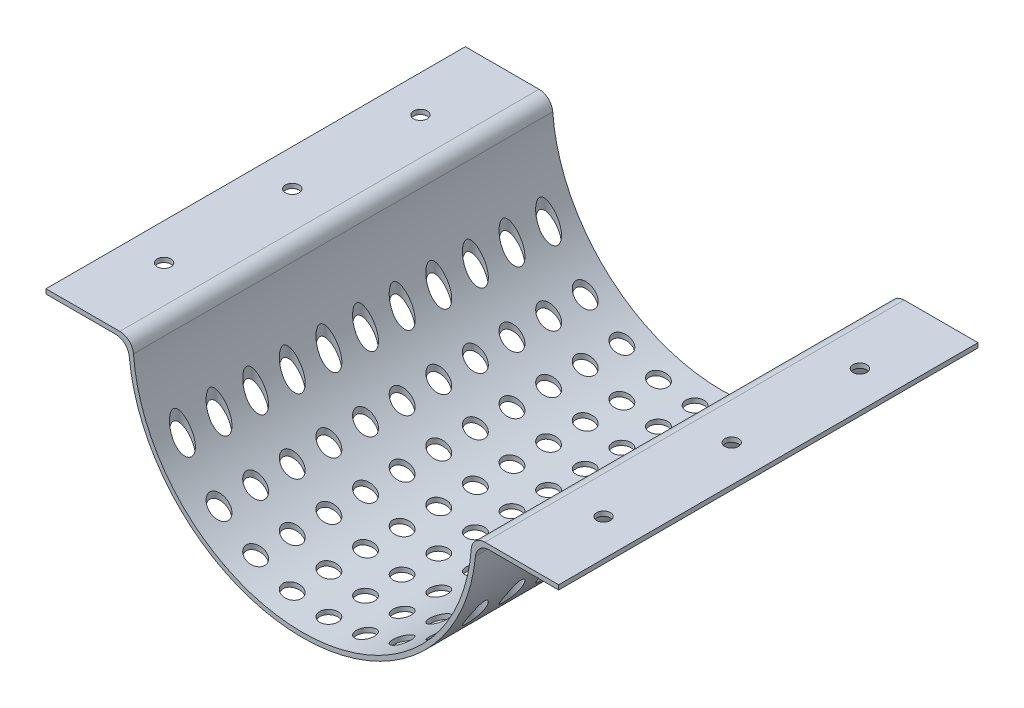
from build123d import *

# Parameters (mm, degrees)
BOSS_EXTRUDE1_DEPTH = 145.415
SKETCH2_R           = 6.35
CUT_EXTRUDE1_DEPTH  = 304.8
SKETCH3_R           = 4.7625
CUT_EXTRUDE2_DEPTH  = 76.2


with BuildPart() as part:
    # Sketch1 → Boss-Extrude1 (new, symmetric)
    with BuildSketch(Plane.XY):
        with BuildLine():
            Line((126.642308787, 0), (177.8, 0))
            Line((177.8, 0), (177.8, -3.175))
            Line((177.8, -3.175), (129.554006596, -3.175))
            ThreePointArc((129.554006596, -3.175), (123.155790262, -5.643906694), (120.074445137, -11.770731707))
            ThreePointArc((120.074445137, -11.770731707), (0, -120.65), (-120.074445137, -11.770731707))
            ThreePointArc((-120.074445137, -11.770731707), (-123.155790262, -5.643906694), (-129.554006596, -3.175))
            Line((-129.554006596, -3.175), (-177.8, -3.175))
            Line((-177.8, -3.175), (-177.8, 0))
            Line((-177.8, 0), (-126.642308787, 0))
            ThreePointArc((-126.642308787, 0), (-120.164608458, -2.54180421), (-117.144135628, -8.810625))
            ThreePointArc((-117.144135628, -8.810625), (0, -117.475), (117.144135628, -8.810625))
            ThreePointArc((117.144135628, -8.810625), (120.164608458, -2.54180421), (126.642308787, 0))
        make_face()
    extrude(amount=BOSS_EXTRUDE1_DEPTH, both=True)

    # Sketch2 → Cut-Extrude1 (cut)
    with BuildSketch(Plane(origin=(0, 0, 0), x_dir=(1, 0, 0), z_dir=(0, 1, 0))):
        Circle(SKETCH2_R)
        with Locations((25.4, 0)):
            Circle(SKETCH2_R)
        with Locations((50.8, 0)):
            Circle(SKETCH2_R)
        with Locations((76.2, 0)):
            Circle(SKETCH2_R)
        with Locations((101.6, 0)):
            Circle(SKETCH2_R)
        with Locations((-50.8, 0)):
            Circle(SKETCH2_R)
        with Locations((-101.6, 0)):
            Circle(SKETCH2_R)
        with Locations((-76.2, 0)):
            Circle(SKETCH2_R)
        with Locations((-25.4, 0)):
            Circle(SKETCH2_R)
        with Locations((0, -25.4)):
            Circle(SKETCH2_R)
        with Locations((25.4, -25.4)):
            Circle(SKETCH2_R)
        with Locations((50.8, -25.4)):
            Circle(SKETCH2_R)
        with Locations((76.2, -25.4)):
            Circle(SKETCH2_R)
        with Locations((101.6, -25.4)):
            Circle(SKETCH2_R)
        with Locations((-50.8, -25.4)):
            Circle(SKETCH2_R)
        with Locations((-101.6, -25.4)):
            Circle(SKETCH2_R)
        with Locations((-76.2, -25.4)):
            Circle(SKETCH2_R)
        with Locations((-25.4, -25.4)):
            Circle(SKETCH2_R)
        with Locations((0, -50.8)):
            Circle(SKETCH2_R)
        with Locations((25.4, -50.8)):
            Circle(SKETCH2_R)
        with Locations((50.8, -50.8)):
            Circle(SKETCH2_R)
        with Locations((76.2, -50.8)):
            Circle(SKETCH2_R)
        with Locations((101.6, -50.8)):
            Circle(SKETCH2_R)
        with Locations((-50.8, -50.8)):
            Circle(SKETCH2_R)
        with Locations((-101.6, -50.8)):
            Circle(SKETCH2_R)
        with Locations((-76.2, -50.8)):
            Circle(SKETCH2_R)
        with Locations((-25.4, -50.8)):
            Circle(SKETCH2_R)
        with Locations((0, -76.2)):
            Circle(SKETCH2_R)
        with Locations((25.4, -76.2)):
            Circle(SKETCH2_R)
        with Locations((50.8, -76.2)):
            Circle(SKETCH2_R)
        with Locations((76.2, -76.2)):
            Circle(SKETCH2_R)
        with Locations((101.6, -76.2)):
            Circle(SKETCH2_R)
        with Locations((-50.8, -76.2)):
            Circle(SKETCH2_R)
        with Locations((-101.6, -76.2)):
            Circle(SKETCH2_R)
        with Locations((-76.2, -76.2)):
            Circle(SKETCH2_R)
        with Locations((-25.4, -76.2)):
            Circle(SKETCH2_R)
        with Locations((0, -101.6)):
            Circle(SKETCH2_R)
        with Locations((25.4, -101.6)):
            Circle(SKETCH2_R)
        with Locations((50.8, -101.6)):
            Circle(SKETCH2_R)
        with Locations((76.2, -101.6)):
            Circle(SKETCH2_R)
        with Locations((101.6, -101.6)):
            Circle(SKETCH2_R)
        with Locations((-50.8, -101.6)):
            Circle(SKETCH2_R)
        with Locations((-101.6, -101.6)):
            Circle(SKETCH2_R)
        with Locations((-76.2, -101.6)):
            Circle(SKETCH2_R)
        with Locations((-25.4, -101.6)):
            Circle(SKETCH2_R)
        with Locations((0, -127)):
            Circle(SKETCH2_R)
        with Locations((25.4, -127)):
            Circle(SKETCH2_R)
        with Locations((50.8, -127)):
            Circle(SKETCH2_R)
        with Locations((76.2, -127)):
            Circle(SKETCH2_R)
        with Locations((101.6, -127)):
            Circle(SKETCH2_R)
        with Locations((-50.8, -127)):
            Circle(SKETCH2_R)
        with Locations((-101.6, -127)):
            Circle(SKETCH2_R)
        with Locations((-76.2, -127)):
            Circle(SKETCH2_R)
        with Locations((-25.4, -127)):
            Circle(SKETCH2_R)
        with Locations((-25.4, 127)):
            Circle(SKETCH2_R)
        with Locations((-76.2, 127)):
            Circle(SKETCH2_R)
        with Locations((-101.6, 127)):
            Circle(SKETCH2_R)
        with Locations((-50.8, 127)):
            Circle(SKETCH2_R)
        with Locations((101.6, 127)):
            Circle(SKETCH2_R)
        with Locations((76.2, 127)):
            Circle(SKETCH2_R)
        with Locations((50.8, 127)):
            Circle(SKETCH2_R)
        with Locations((25.4, 127)):
            Circle(SKETCH2_R)
        with Locations((0, 127)):
            Circle(SKETCH2_R)
        with Locations((-25.4, 101.6)):
            Circle(SKETCH2_R)
        with Locations((-76.2, 101.6)):
            Circle(SKETCH2_R)
        with Locations((-101.6, 101.6)):
            Circle(SKETCH2_R)
        with Locations((-50.8, 101.6)):
            Circle(SKETCH2_R)
        with Locations((101.6, 101.6)):
            Circle(SKETCH2_R)
        with Locations((76.2, 101.6)):
            Circle(SKETCH2_R)
        with Locations((50.8, 101.6)):
            Circle(SKETCH2_R)
        with Locations((25.4, 101.6)):
            Circle(SKETCH2_R)
        with Locations((0, 101.6)):
            Circle(SKETCH2_R)
        with Locations((-25.4, 76.2)):
            Circle(SKETCH2_R)
        with Locations((-76.2, 76.2)):
            Circle(SKETCH2_R)
        with Locations((-101.6, 76.2)):
            Circle(SKETCH2_R)
        with Locations((-50.8, 76.2)):
            Circle(SKETCH2_R)
        with Locations((101.6, 76.2)):
            Circle(SKETCH2_R)
        with Locations((76.2, 76.2)):
            Circle(SKETCH2_R)
        with Locations((50.8, 76.2)):
            Circle(SKETCH2_R)
        with Locations((25.4, 76.2)):
            Circle(SKETCH2_R)
        with Locations((0, 76.2)):
            Circle(SKETCH2_R)
        with Locations((-25.4, 50.8)):
            Circle(SKETCH2_R)
        with Locations((-76.2, 50.8)):
            Circle(SKETCH2_R)
        with Locations((-101.6, 50.8)):
            Circle(SKETCH2_R)
        with Locations((-50.8, 50.8)):
            Circle(SKETCH2_R)
        with Locations((101.6, 50.8)):
            Circle(SKETCH2_R)
        with Locations((76.2, 50.8)):
            Circle(SKETCH2_R)
        with Locations((50.8, 50.8)):
            Circle(SKETCH2_R)
        with Locations((25.4, 50.8)):
            Circle(SKETCH2_R)
        with Locations((0, 50.8)):
            Circle(SKETCH2_R)
        with Locations((-25.4, 25.4)):
            Circle(SKETCH2_R)
        with Locations((-76.2, 25.4)):
            Circle(SKETCH2_R)
        with Locations((-101.6, 25.4)):
            Circle(SKETCH2_R)
        with Locations((-50.8, 25.4)):
            Circle(SKETCH2_R)
        with Locations((101.6, 25.4)):
            Circle(SKETCH2_R)
        with Locations((76.2, 25.4)):
            Circle(SKETCH2_R)
        with Locations((50.8, 25.4)):
            Circle(SKETCH2_R)
        with Locations((25.4, 25.4)):
            Circle(SKETCH2_R)
        with Locations((0, 25.4)):
            Circle(SKETCH2_R)
    extrude(amount=-CUT_EXTRUDE1_DEPTH, mode=Mode.SUBTRACT)

    # Sketch3 → Cut-Extrude2 (cut)
    with BuildSketch(Plane(origin=(0, 0, 0), x_dir=(1, 0, 0), z_dir=(0, 1, 0))):
        with Locations((152.4, 0)):
            Circle(SKETCH3_R)
        with Locations((152.4, 88.9)):
            Circle(SKETCH3_R)
        with Locations((152.4, -88.9)):
            Circle(SKETCH3_R)
        with Locations((-152.4, -88.9)):
            Circle(SKETCH3_R)
        with Locations((-152.4, 0)):
            Circle(SKETCH3_R)
        with Locations((-152.4, 88.9)):
            Circle(SKETCH3_R)
    extrude(amount=-CUT_EXTRUDE2_DEPTH, mode=Mode.SUBTRACT)


solid = part.part
